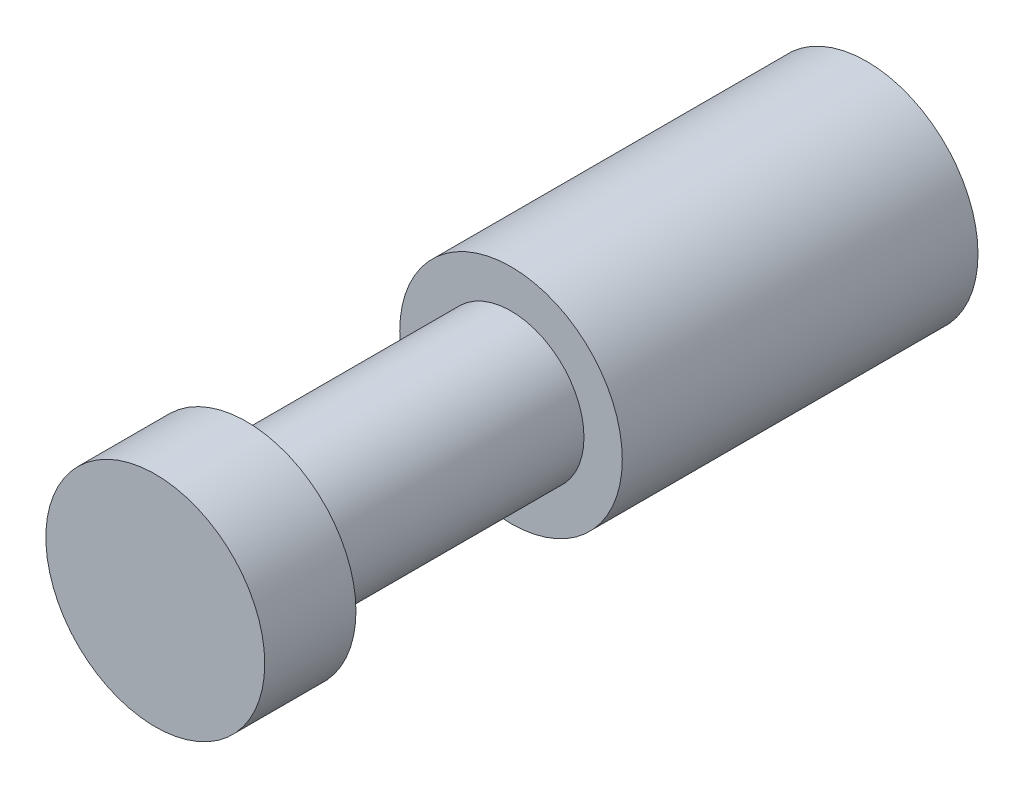
from build123d import *

# Parameters (mm, degrees)
SKETCH1_R           = 6.1
SKETCH1_R_2         = 4.25
BOSS_EXTRUDE1_DEPTH = 12
SKETCH2_R           = 6.1
BOSS_EXTRUDE2_DEPTH = 2
SKETCH3_R           = 4
BOSS_EXTRUDE3_DEPTH = 20
SKETCH4_R           = 6
BOSS_EXTRUDE4_DEPTH = 5
SKETCH5_R           = 6.1
BOSS_EXTRUDE5_DEPTH = 5.5


with BuildPart() as part:
    # Sketch1 → Boss-Extrude1 (new body)
    with BuildSketch(Plane.XY):
        Circle(SKETCH1_R)
        Circle(SKETCH1_R_2, mode=Mode.SUBTRACT)
    extrude(amount=BOSS_EXTRUDE1_DEPTH)

    # Sketch2 → Boss-Extrude2 (add)
    with BuildSketch(Plane.XY.offset(12)):
        Circle(SKETCH2_R)
    extrude(amount=BOSS_EXTRUDE2_DEPTH)

    # Sketch3 → Boss-Extrude3 (add)
    with BuildSketch(Plane.XY.offset(14)):
        Circle(SKETCH3_R)
    extrude(amount=BOSS_EXTRUDE3_DEPTH)

    # Sketch4 → Boss-Extrude4 (add)
    with BuildSketch(Plane.XY.offset(34)):
        Circle(SKETCH4_R)
    extrude(amount=BOSS_EXTRUDE4_DEPTH)

    # Sketch5 → Boss-Extrude5 (add)
    with BuildSketch(Plane.XY.offset(14)):
        Circle(SKETCH5_R)
    extrude(amount=BOSS_EXTRUDE5_DEPTH)


solid = part.part
